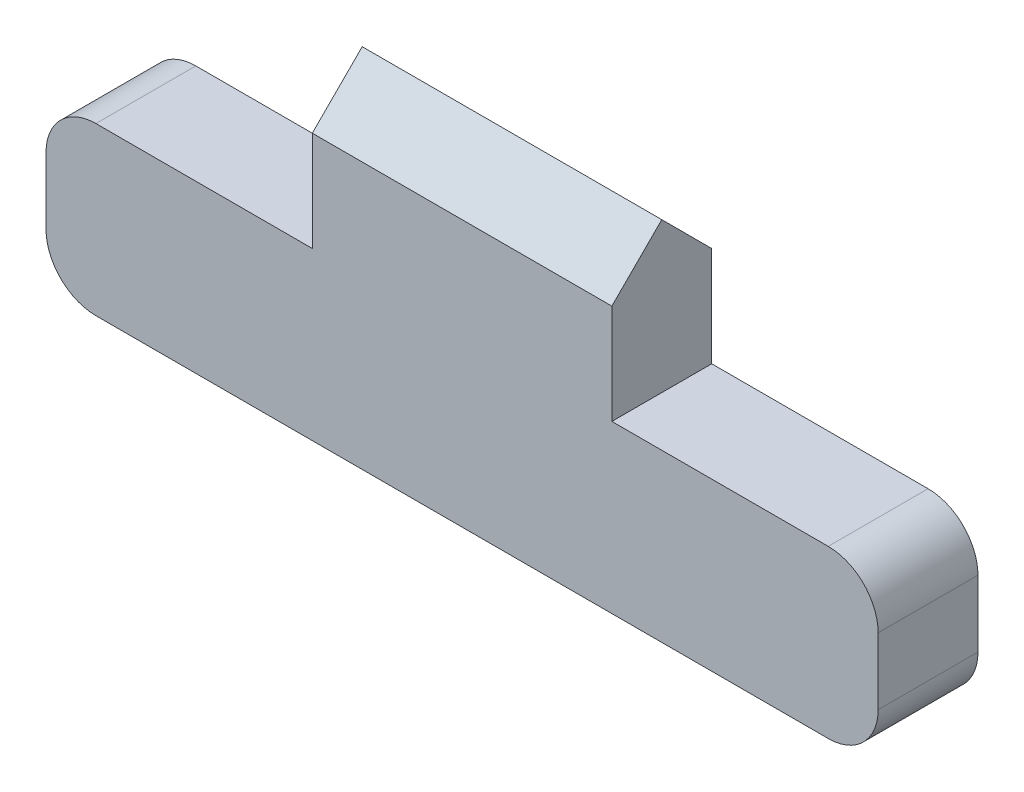
from build123d import *

# Parameters (mm, degrees)
EXTRUDE_1_DEPTH = 6
FILLET_1_R      = 3
CHAMFER_1_SIZE  = 3


with BuildPart() as part:
    # 草图1 → 凸台-拉伸1 (new body)
    with BuildSketch(Plane.XY):
        Polygon((-25, 0), (25, 0), (25, 10), (9, 10), (9, 19), (-9, 19), (-9, 10), (-25, 10), align=None)
    extrude(amount=EXTRUDE_1_DEPTH)

    # 圆角1
    fillet_1_edges = [part.edges().sort_by_distance(p)[0] for p in [
        (25, 10, 3),
        (25, 0, 3),
        (-25, 0, 3),
        (-25, 10, 3),
    ]]
    fillet(fillet_1_edges, radius=FILLET_1_R)

    # 倒角1
    chamfer_1_edges = [part.edges().sort_by_distance(p)[0] for p in [
        (0, 19, 6),
        (0, 19, 0),
    ]]
    chamfer(chamfer_1_edges, length=CHAMFER_1_SIZE - 0.0001)  # a hair under: the kernel refuses the full size


solid = part.part
